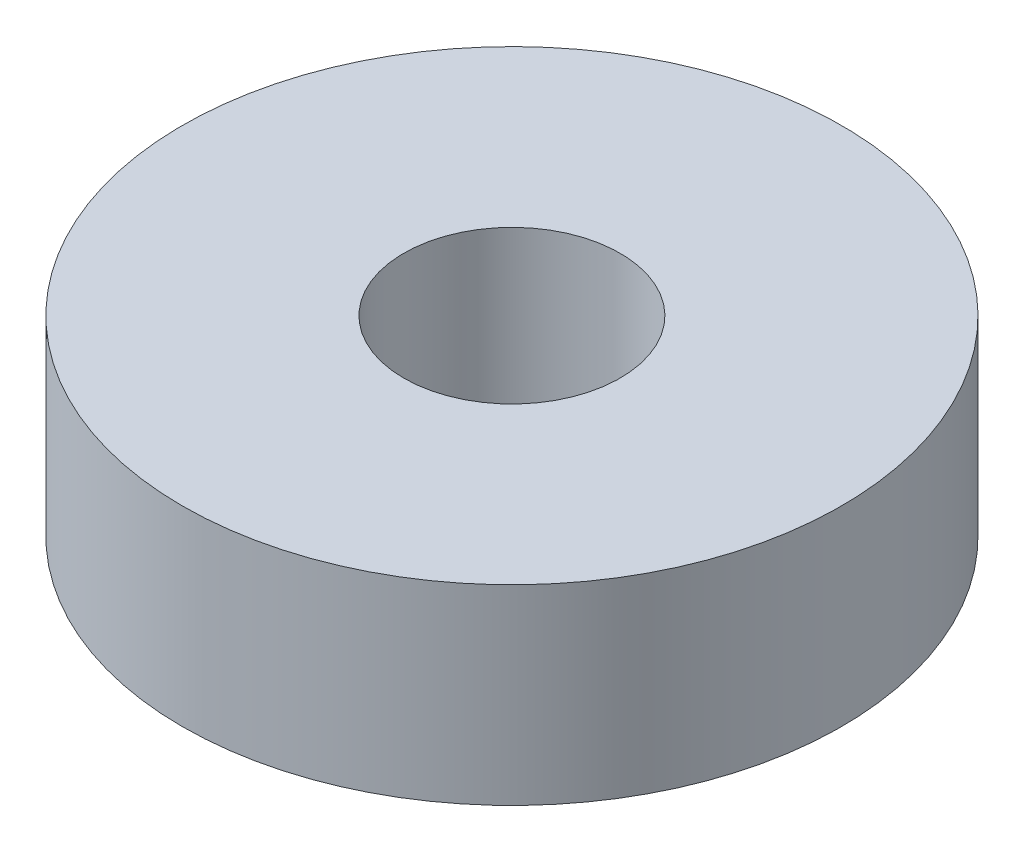
from build123d import *

# Parameters (mm, degrees)
SKETCH1_R           = 15
SKETCH1_R_2         = 4.925
BOSS_EXTRUDE1_DEPTH = 8.7


with BuildPart() as part:
    # Sketch1 → Boss-Extrude1 (new body)
    with BuildSketch(Plane(origin=(0, 0, 0), x_dir=(1, 0, 0), z_dir=(0, 1, 0))):
        Circle(SKETCH1_R)
        Circle(SKETCH1_R_2, mode=Mode.SUBTRACT)
    extrude(amount=BOSS_EXTRUDE1_DEPTH)


solid = part.part
